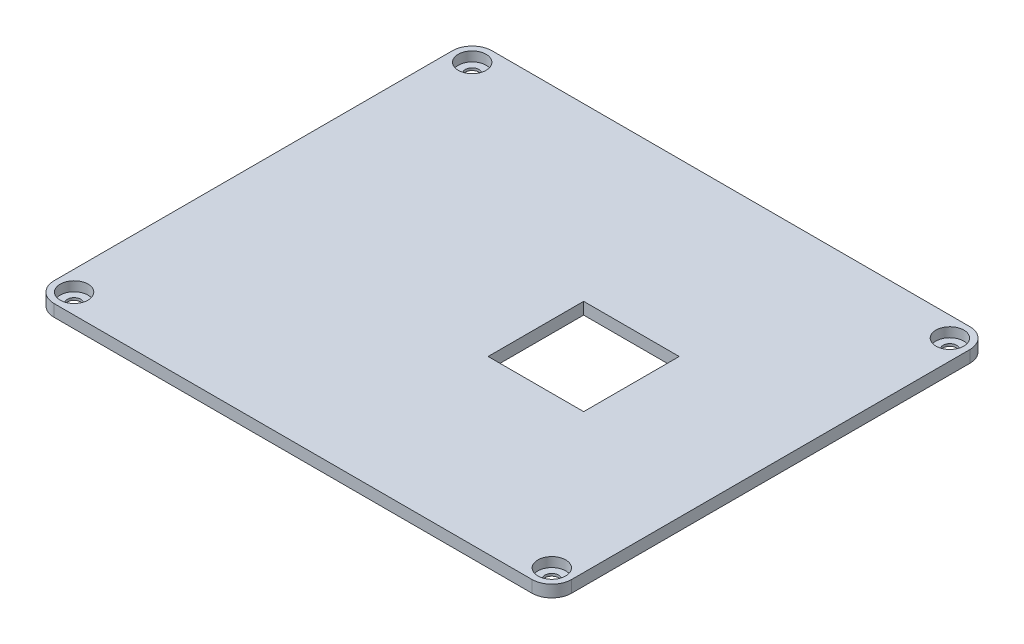
from build123d import *

# Parameters (mm, degrees)
SKETCH1_W                                        = 130
SKETCH1_H                                        = 110
BOSS_EXTRUDE1_DEPTH                              = 3
CBORE_FOR_M3_PAN_HEAD_MACHINE_SCREW1_D           = 3.4
CBORE_FOR_M3_PAN_HEAD_MACHINE_SCREW1_DEPTH       = 7
CBORE_FOR_M3_PAN_HEAD_MACHINE_SCREW1_CBORE_D     = 7
CBORE_FOR_M3_PAN_HEAD_MACHINE_SCREW1_CBORE_DEPTH = 2.4
CBORE_FOR_M3_PAN_HEAD_MACHINE_SCREW1_TIP         = 1.021463052
SKETCH10_W                                       = 24
SKETCH10_H                                       = 24
CUT_EXTRUDE1_DEPTH                               = 5
FILLET1_R                                        = 5


with BuildPart() as part:
    # Sketch1 → Boss-Extrude1 (new body)
    with BuildSketch(Plane(origin=(0, 0, 0), x_dir=(1, 0, 0), z_dir=(0, 1, 0))):
        with Locations((65, 55)):
            Rectangle(SKETCH1_W, SKETCH1_H)
    extrude(amount=BOSS_EXTRUDE1_DEPTH)

    # CBORE for M3 Pan Head Machine Screw1
    with Locations(Plane(origin=(0, 3, 0), x_dir=(1, 0, 0), z_dir=(0, 1, 0))):
        with Locations((5, 105), (125, 105), (125, 5), (5, 5)):
            CounterBoreHole(CBORE_FOR_M3_PAN_HEAD_MACHINE_SCREW1_D / 2, CBORE_FOR_M3_PAN_HEAD_MACHINE_SCREW1_CBORE_D / 2, CBORE_FOR_M3_PAN_HEAD_MACHINE_SCREW1_CBORE_DEPTH, depth=CBORE_FOR_M3_PAN_HEAD_MACHINE_SCREW1_DEPTH)
            with Locations((0, 0, -(CBORE_FOR_M3_PAN_HEAD_MACHINE_SCREW1_DEPTH + CBORE_FOR_M3_PAN_HEAD_MACHINE_SCREW1_TIP / 2))):  # 118° drill point
                Cone(0, CBORE_FOR_M3_PAN_HEAD_MACHINE_SCREW1_D / 2, CBORE_FOR_M3_PAN_HEAD_MACHINE_SCREW1_TIP, mode=Mode.SUBTRACT)

    # Sketch10 → Cut-Extrude1 (cut)
    with BuildSketch(Plane(origin=(0, 3, 0), x_dir=(1, 0, 0), z_dir=(0, 1, 0))):
        with Locations((83, 55)):
            Rectangle(SKETCH10_W, SKETCH10_H)
    extrude(amount=-CUT_EXTRUDE1_DEPTH, mode=Mode.SUBTRACT)

    # Fillet1
    fillet1_edges = [part.edges().sort_by_distance(p)[0] for p in [
        (0, 1.5, -110),
        (0, 1.5, 0),
        (130, 1.5, -110),
        (130, 1.5, 0),
    ]]
    fillet(fillet1_edges, radius=FILLET1_R)


solid = part.part
